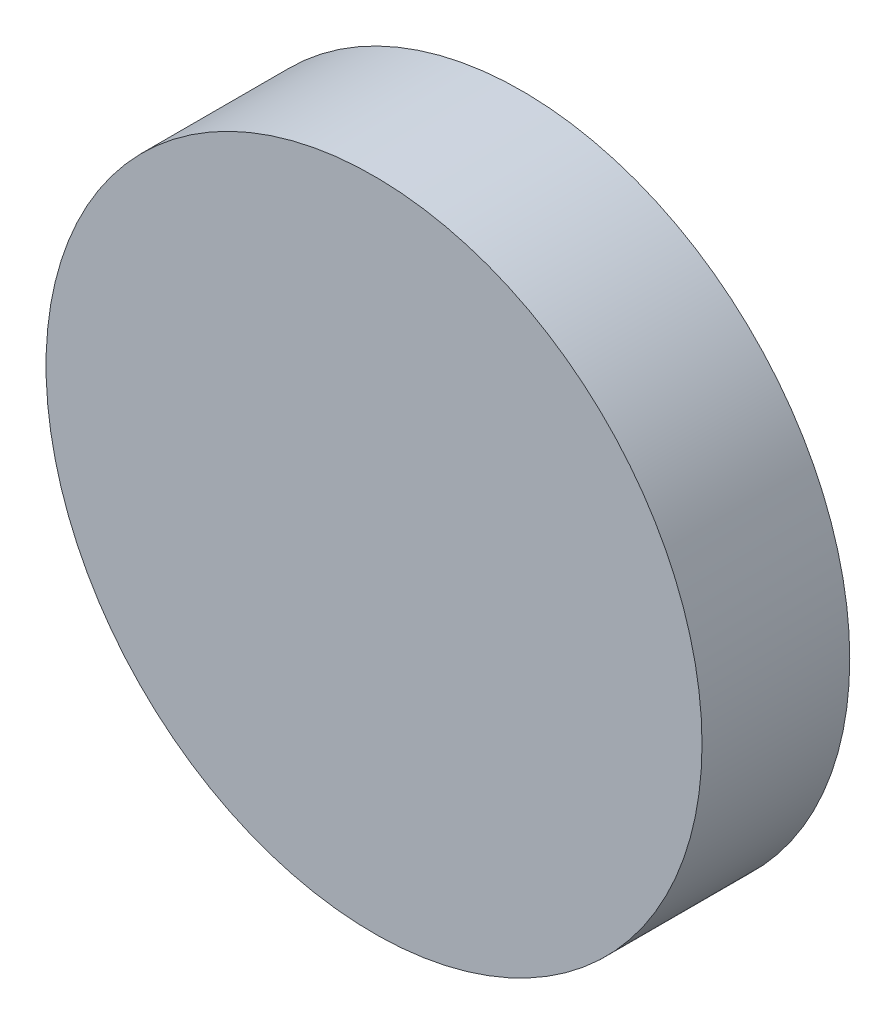
from build123d import *

# Parameters (mm, degrees)
SKETCH1_R           = 4.440371606
BOSS_EXTRUDE1_DEPTH = 2


with BuildPart() as part:
    # Sketch1 → Boss-Extrude1 (new body)
    with BuildSketch(Plane.XY.offset(-12)):
        Circle(SKETCH1_R)
    extrude(amount=BOSS_EXTRUDE1_DEPTH)


solid = part.part
